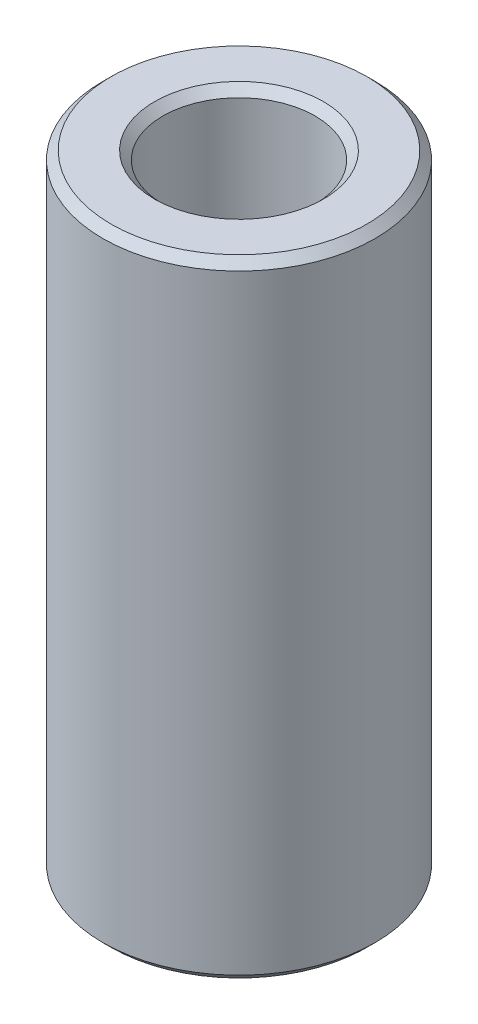
from build123d import *

# Parameters (mm, degrees)
SKETCH1_R           = 45
BOSS_EXTRUDE1_DEPTH = 207.014856227
SKETCH2_R           = 25.176798108
CUT_EXTRUDE1_DEPTH  = 217.575969809
CHAMFER1_SIZE       = 2.743396084


with BuildPart() as part:
    # Sketch1 → Boss-Extrude1 (new body)
    with BuildSketch(Plane(origin=(0, 0, 0), x_dir=(1, 0, 0), z_dir=(0, 1, 0))):
        Circle(SKETCH1_R)
    extrude(amount=BOSS_EXTRUDE1_DEPTH)

    # Sketch2 → Cut-Extrude1 (cut, through all)
    with BuildSketch(Plane(origin=(0, 0, 0), x_dir=(1, 0, 0), z_dir=(0, 1, 0))):
        Circle(SKETCH2_R)
    extrude(amount=CUT_EXTRUDE1_DEPTH, mode=Mode.SUBTRACT)

    # Chamfer1
    chamfer1_edges = [part.edges().sort_by_distance(p)[0] for p in [
        (-25.176798108, 207.014856227, 0),
        (-25.176798108, 0, 0),
        (-45, 0, 0),
        (-45, 207.014856227, 0),
    ]]
    chamfer(chamfer1_edges, length=CHAMFER1_SIZE)


solid = part.part
